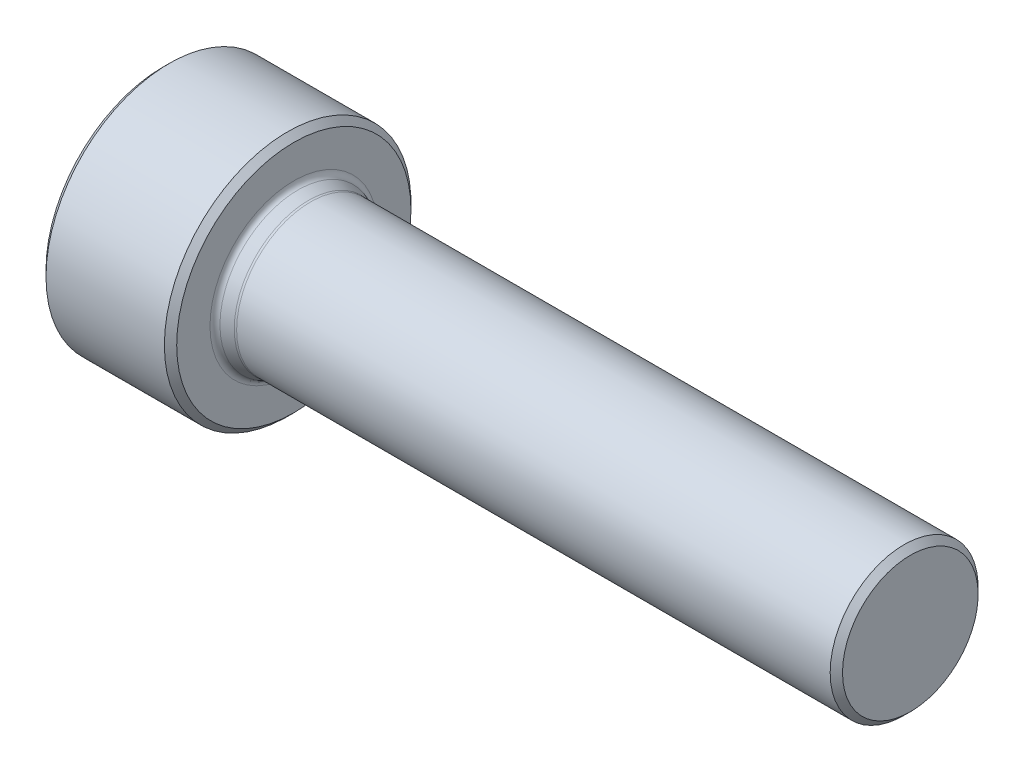
from build123d import *

# Parameters (mm, degrees)
CUT_EXTRUDE_1_DEPTH = 3
CHAMFER_1_SIZE      = 0.25


with BuildPart() as part:
    # Эскиз1 → Повернуть1 (revolve)
    with BuildSketch(Plane.XY):
        with BuildLine():
            Line((-4.982457352, 2.5), (-5.3, 3.05))
            Line((-5.3, 3.05), (-5.3, 5))
            Line((-5.3, 5), (0, 5))
            Line((0, 5), (0, 3.4))
            ThreePointArc((0, 3.4), (0.046179295, 3.255234258), (0.167656961, 3.163949955))
            Line((0.167656961, 3.163949955), (0.597656961, 3.013949955))
            ThreePointArc((0.597656961, 3.013949955), (0.638241835, 3.003512159), (0.68, 3))
            Line((0.68, 3), (25, 3))
            Line((25, 3), (25, 0))
            Line((25, 0), (-0.856624327, 0))
            Line((-0.856624327, 0), (-2.3, 2.5))
            Line((-2.3, 2.5), (-4.982457352, 2.5))
        make_face()
    revolve(axis=Axis((-1000, 0, 0), (1, 0, 0)))

    # Эскиз2 → Вырез-Вытянуть1 (cut)
    with BuildSketch(Plane.ZY.offset(5.3)):
        with BuildLine():
            Line((-0.038113557, 2.864746473), (-2.461886443, 1.465380546))
            ThreePointArc((-2.461886443, 1.465380546), (-2.481162782, 1.4325), (-2.5, 1.399365928))
            Line((-2.5, 1.399365928), (-2.5, -1.399365928))
            ThreePointArc((-2.5, -1.399365928), (-2.481162782, -1.4325), (-2.461886443, -1.465380546))
            Line((-2.461886443, -1.465380546), (-0.038113557, -2.864746473))
            ThreePointArc((-0.038113557, -2.864746473), (0, -2.865), (0.038113557, -2.864746473))
            Line((0.038113557, -2.864746473), (2.461886443, -1.465380546))
            ThreePointArc((2.461886443, -1.465380546), (2.481162782, -1.4325), (2.5, -1.399365928))
            Line((2.5, -1.399365928), (2.5, 1.399365928))
            ThreePointArc((2.5, 1.399365928), (2.481162782, 1.4325), (2.461886443, 1.465380546))
            Line((2.461886443, 1.465380546), (0.038113557, 2.864746473))
            ThreePointArc((0.038113557, 2.864746473), (0, 2.865), (-0.038113557, 2.864746473))
        make_face()
    extrude(amount=-CUT_EXTRUDE_1_DEPTH, mode=Mode.SUBTRACT)

    # Фаска1
    chamfer_1_edges = [part.edges().sort_by_distance(p)[0] for p in [
        (0, -5, 0),
        (-5.3, -5, 0),
        (25, -3, 0),
    ]]
    chamfer(chamfer_1_edges, length=CHAMFER_1_SIZE)


solid = part.part
